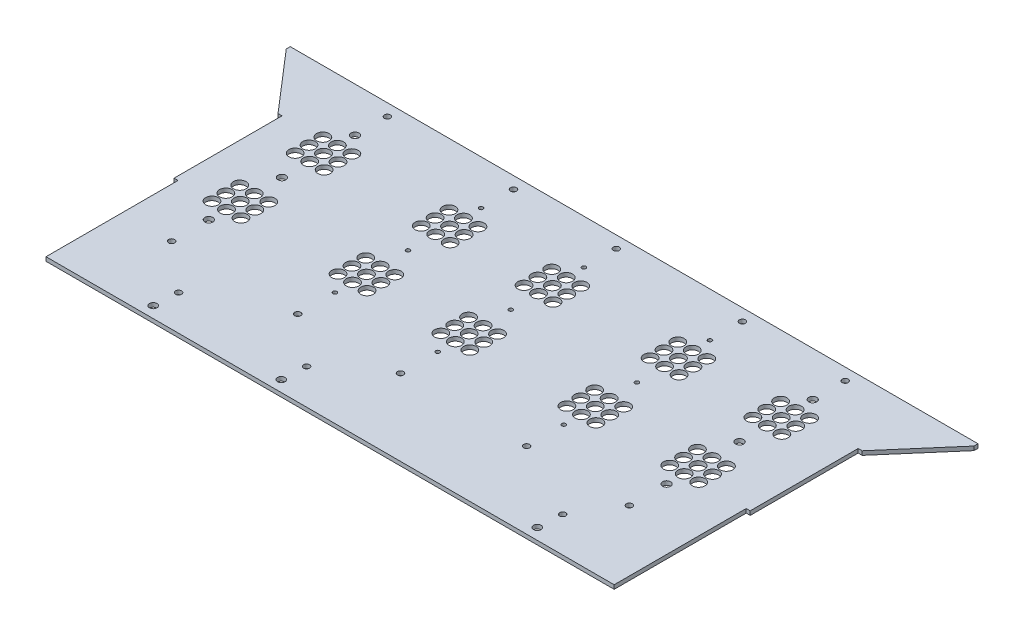
from build123d import *

# Parameters (mm, degrees)
SKETCH1_W            = 457.22286
SKETCH1_H            = 3.175
BOSS_EXTRUDE1_DEPTH  = 241.274380036
BOSS_EXTRUDE3_DEPTH  = 3.175
SKETCH5_W            = 3.175
SKETCH5_H            = 104.775
CUT_EXTRUDE2_DEPTH   = 3.175
SKETCH37_R           = 3
CUT_EXTRUDE12_DEPTH  = 3.175
LPATTERN31_COUNT     = 4
LPATTERN31_PITCH     = 101.6
M4_CLEARANCE_HOLE1_D = 4.8
LPATTERN32_COUNT     = 3
LPATTERN32_PITCH     = 181.61399999
M4_CLEARANCE_HOLE2_D = 4.8
LPATTERN33_COUNT     = 2
LPATTERN33_PITCH     = 181.61399999
M4_CLEARANCE_HOLE3_D = 4.8
SKETCH45_R           = 5
CUT_EXTRUDE13_DEPTH  = 365.26675509
LPATTERN34_COUNT     = 2
LPATTERN34_PITCH     = 181.61399999
SKETCH46_R           = 5
CUT_EXTRUDE14_DEPTH  = 365.26675509
LPATTERN35_COUNT     = 3
LPATTERN35_PITCH     = 181.61399999
SKETCH47_R           = 3.175
CUT_EXTRUDE15_DEPTH  = 365.26675509
SKETCH48_R           = 1.5875
CUT_EXTRUDE16_DEPTH  = 365.26675509


with BuildPart() as part:
    # Sketch1 → Boss-Extrude1 (new body)
    with BuildSketch(Plane.XY):
        Rectangle(SKETCH1_W, SKETCH1_H)
    extrude(amount=BOSS_EXTRUDE1_DEPTH)

    # Sketch4 → Boss-Extrude3 (add)
    with BuildSketch(Plane.XZ.offset(1.5875)):
        Polygon((-272.88617, 0), (-228.61143, 0), (-228.61143, 50.8), (-231.78643, 50.8), (-272.88617, 3.175), align=None)
    boss_extrude3 = extrude(amount=-BOSS_EXTRUDE3_DEPTH)

    # Mirror1: Boss-Extrude3 across plane
    add(boss_extrude3.mirror(Plane(origin=(0, 0, 0), x_dir=(0, 0, 1), z_dir=(1, 0, 0))))

    # Sketch5 → Cut-Extrude2 (cut)
    with BuildSketch(Plane.XZ.offset(1.5875)):
        with Locations((-227.02393, 188.886880036)):
            Rectangle(SKETCH5_W, SKETCH5_H)
    cut_extrude2 = extrude(amount=-CUT_EXTRUDE2_DEPTH, mode=Mode.SUBTRACT)

    # Mirror2: Cut-Extrude2 across plane
    add(cut_extrude2.mirror(Plane(origin=(0, 0, 0), x_dir=(0, 0, 1), z_dir=(1, 0, 0))), mode=Mode.SUBTRACT)

    # Sketch37 → Cut-Extrude12 (cut)
    with BuildSketch(Plane(origin=(0, 1.5875, 0), x_dir=(1, 0, 0), z_dir=(0, 1, 0))):
        with Locations((-149.23643, -232.384380036)):
            Circle(SKETCH37_R)
    cut_extrude12 = extrude(amount=-CUT_EXTRUDE12_DEPTH, mode=Mode.SUBTRACT)

    # LPattern31: Cut-Extrude12 ×4, 1 skipped
    with Locations(*[(i * LPATTERN31_PITCH, 0, 0) for i in range(1, LPATTERN31_COUNT) if i not in (2,)]):
        add(cut_extrude12, mode=Mode.SUBTRACT)

    # M4 Clearance Hole1 (through all)
    with Locations(Plane(origin=(0, 1.5875, 0), x_dir=(1, 0, 0), z_dir=(0, 1, 0))):
        with Locations((-186.2355, -180.775), (-186.2355, -9.525)):
            m4_clearance_hole1 = Hole(M4_CLEARANCE_HOLE1_D / 2)

    # LPattern32: M4 Clearance Hole1 ×3
    with Locations(*[(i * LPATTERN32_PITCH, 0, 0) for i in range(1, LPATTERN32_COUNT)]):
        add(m4_clearance_hole1, mode=Mode.SUBTRACT)

    # M4 Clearance Hole2 (through all)
    with Locations(Plane(origin=(0, 1.5875, 0), x_dir=(1, 0, 0), z_dir=(0, 1, 0))):
        with Locations((-86.1905, -180.775), (-86.1905, -9.525)):
            m4_clearance_hole2 = Hole(M4_CLEARANCE_HOLE2_D / 2)

    # LPattern33: M4 Clearance Hole2 ×2
    with Locations(*[(i * LPATTERN33_PITCH, 0, 0) for i in range(1, LPATTERN33_COUNT)]):
        add(m4_clearance_hole2, mode=Mode.SUBTRACT)

    # M4 Clearance Hole3 (through all)
    with Locations(Plane(origin=(0, 1.5875, 0), x_dir=(1, 0, 0), z_dir=(0, 1, 0))):
        with Locations((-148.209993257, -213.2849914), (-46.609993257, -213.2849914), (156.590006743, -213.2849914)):
            Hole(M4_CLEARANCE_HOLE3_D / 2)

    # Sketch45 → Cut-Extrude13 (cut, through all)
    with BuildSketch(Plane(origin=(0, 1.5875, 0), x_dir=(1, 0, 0), z_dir=(0, 1, 0))):
        with Locations((-74.6905, -115.256662939)):
            Circle(SKETCH45_R)
        with Locations((-86.1905, -115.256662939)):
            Circle(SKETCH45_R)
        with Locations((-97.6905, -115.256662939)):
            Circle(SKETCH45_R)
        with Locations((-97.6905, -126.256662939)):
            Circle(SKETCH45_R)
        with Locations((-86.1905, -126.256662939)):
            Circle(SKETCH45_R)
        with Locations((-74.6905, -126.256662939)):
            Circle(SKETCH45_R)
        with Locations((-97.6905, -137.256662939)):
            Circle(SKETCH45_R)
        with Locations((-74.6905, -137.256662939)):
            Circle(SKETCH45_R)
        with Locations((-86.1905, -137.256662939)):
            Circle(SKETCH45_R)
        with Locations((-97.6905, -71.256662939)):
            Circle(SKETCH45_R)
        with Locations((-86.1905, -71.256662939)):
            Circle(SKETCH45_R)
        with Locations((-74.6905, -71.256662939)):
            Circle(SKETCH45_R)
        with Locations((-74.6905, -60.256662939)):
            Circle(SKETCH45_R)
        with Locations((-86.1905, -60.256662939)):
            Circle(SKETCH45_R)
        with Locations((-97.6905, -60.256662939)):
            Circle(SKETCH45_R)
        with Locations((-97.6905, -49.256662939)):
            Circle(SKETCH45_R)
        with Locations((-86.1905, -49.256662939)):
            Circle(SKETCH45_R)
        with Locations((-74.6905, -49.256662939)):
            Circle(SKETCH45_R)
    cut_extrude13 = extrude(amount=-CUT_EXTRUDE13_DEPTH, mode=Mode.SUBTRACT)

    # LPattern34: Cut-Extrude13 ×2
    with Locations(*[(i * LPATTERN34_PITCH, 0, 0) for i in range(1, LPATTERN34_COUNT)]):
        add(cut_extrude13, mode=Mode.SUBTRACT)

    # Sketch46 → Cut-Extrude14 (cut, through all)
    with BuildSketch(Plane(origin=(0, 1.5875, 0), x_dir=(1, 0, 0), z_dir=(0, 1, 0))):
        with Locations((-174.7355, -71.256662939)):
            Circle(SKETCH46_R)
        with Locations((-186.2355, -71.256662939)):
            Circle(SKETCH46_R)
        with Locations((-197.7355, -71.256662939)):
            Circle(SKETCH46_R)
        with Locations((-197.7355, -60.256662939)):
            Circle(SKETCH46_R)
        with Locations((-186.2355, -60.256662939)):
            Circle(SKETCH46_R)
        with Locations((-174.7355, -60.256662939)):
            Circle(SKETCH46_R)
        with Locations((-174.7355, -49.256662939)):
            Circle(SKETCH46_R)
        with Locations((-186.2355, -49.256662939)):
            Circle(SKETCH46_R)
        with Locations((-197.7355, -49.256662939)):
            Circle(SKETCH46_R)
        with Locations((-174.7355, -137.256662939)):
            Circle(SKETCH46_R)
        with Locations((-186.2355, -137.256662939)):
            Circle(SKETCH46_R)
        with Locations((-197.7355, -137.256662939)):
            Circle(SKETCH46_R)
        with Locations((-197.7355, -126.256662939)):
            Circle(SKETCH46_R)
        with Locations((-186.2355, -126.256662939)):
            Circle(SKETCH46_R)
        with Locations((-174.7355, -126.256662939)):
            Circle(SKETCH46_R)
        with Locations((-197.7355, -115.256662939)):
            Circle(SKETCH46_R)
        with Locations((-186.2355, -115.256662939)):
            Circle(SKETCH46_R)
        with Locations((-174.7355, -115.256662939)):
            Circle(SKETCH46_R)
    cut_extrude14 = extrude(amount=-CUT_EXTRUDE14_DEPTH, mode=Mode.SUBTRACT)

    # LPattern35: Cut-Extrude14 ×3
    with Locations(*[(i * LPATTERN35_PITCH, 0, 0) for i in range(1, LPATTERN35_COUNT)]):
        add(cut_extrude14, mode=Mode.SUBTRACT)

    # Sketch47 → Cut-Extrude15 (cut, through all)
    with BuildSketch(Plane(origin=(0, 1.5875, 0), x_dir=(1, 0, 0), z_dir=(0, 1, 0))):
        with Locations((176.992499984, -151.256662939)):
            Circle(SKETCH47_R)
        with Locations((176.96418, -93.256662939)):
            Circle(SKETCH47_R)
        with Locations((176.992499984, -35.256662939)):
            Circle(SKETCH47_R)
        with Locations((-186.2355, -35.256662939)):
            Circle(SKETCH47_R)
        with Locations((-186.2355, -93.256662939)):
            Circle(SKETCH47_R)
        with Locations((-186.2355, -151.256662939)):
            Circle(SKETCH47_R)
    extrude(amount=-CUT_EXTRUDE15_DEPTH, mode=Mode.SUBTRACT)

    # Sketch48 → Cut-Extrude16 (cut, through all)
    with BuildSketch(Plane(origin=(0, 1.5875, 0), x_dir=(1, 0, 0), z_dir=(0, 1, 0))):
        with Locations((95.423499992, -151.256662939)):
            Circle(SKETCH48_R)
        with Locations((95.423499992, -93.256662939)):
            Circle(SKETCH48_R)
        with Locations((95.423499992, -35.256662939)):
            Circle(SKETCH48_R)
        with Locations((-4.62150001, -35.256662939)):
            Circle(SKETCH48_R)
        with Locations((-4.62150001, -93.256662939)):
            Circle(SKETCH48_R)
        with Locations((-4.62150001, -151.256662939)):
            Circle(SKETCH48_R)
        with Locations((-86.1905, -35.256662939)):
            Circle(SKETCH48_R)
        with Locations((-86.1905, -93.256662939)):
            Circle(SKETCH48_R)
        with Locations((-86.1905, -151.256662939)):
            Circle(SKETCH48_R)
    extrude(amount=-CUT_EXTRUDE16_DEPTH, mode=Mode.SUBTRACT)


solid = part.part
